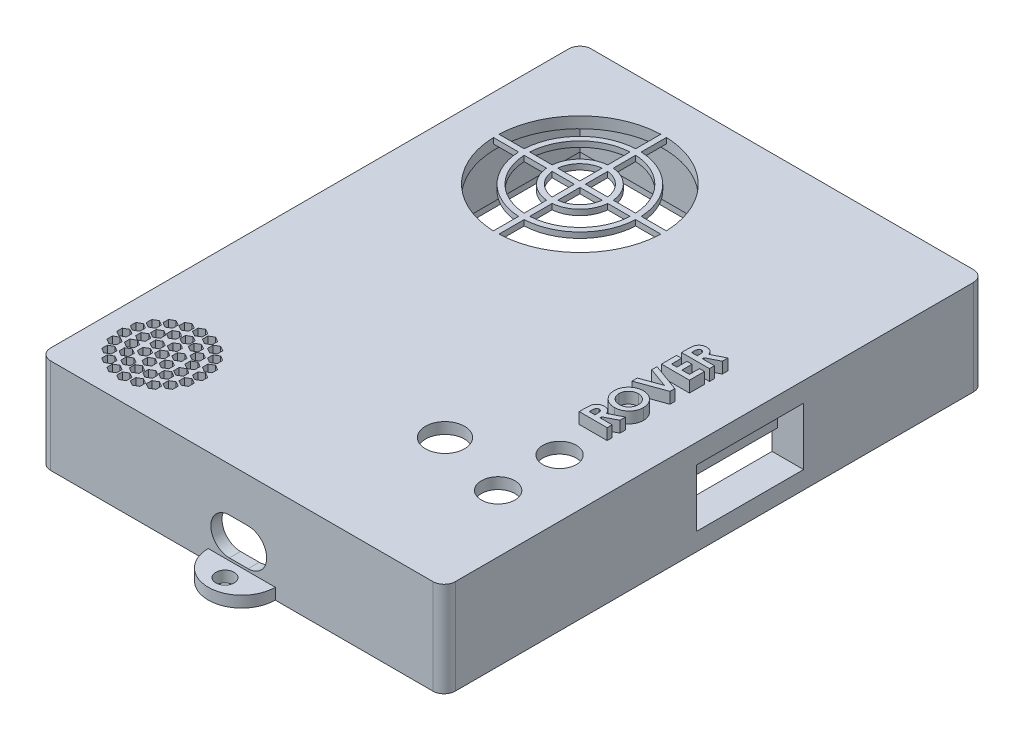
from build123d import *

# Parameters (mm, degrees)
BOSS_EXTRUDE1_START = 10
SKETCH1_W           = 72.5
SKETCH1_H           = 96.828401578
BOSS_EXTRUDE1_DEPTH = 17
SKETCH2_W           = 68.5
SKETCH2_H           = 92.828401578
CUT_EXTRUDE1_DEPTH  = 15
SKETCH3_W           = 70.5
SKETCH3_H           = 94.828401578
SKETCH3_W_2         = 68.5
SKETCH3_H_2         = 92.828401578
CUT_EXTRUDE2_DEPTH  = 2
SKETCH4_R           = 3.5
SKETCH4_R_2         = 3
CUT_EXTRUDE4_DEPTH  = 27
FILLET1_R           = 2
BOSS_EXTRUDE2_START = 10
SKETCH6_R           = 1.65
BOSS_EXTRUDE2_DEPTH = 2
CUT_EXTRUDE5_DEPTH  = 2
VENT1_START         = 25
VENT1_DEPTH         = 2
VENT1_2_DEPTH       = 1
SKETCH12_W          = 21.15
SKETCH12_H          = 12.3
BOSS_EXTRUDE5_DEPTH = 5.65
SKETCH9_W           = 19.15
SKETCH9_H           = 10.3
CUT_EXTRUDE7_DEPTH  = 4.65
SKETCH8_W           = 19.15
SKETCH8_H           = 4.15
CUT_EXTRUDE6_DEPTH  = 5.65
FILL_START          = 25
FILL_PATTERN1_DEPTH = 2
BOSS_EXTRUDE6_DEPTH = 2


# Read off the part's stored shape, not the designer's step: Vent1, Fill Pattern1
with BuildPart() as part:
    # Sketch1 → Boss-Extrude1 (new body)
    with BuildSketch(Plane(origin=(0, 0, 0), x_dir=(1, 0, 0), z_dir=(0, 1, 0)).offset(BOSS_EXTRUDE1_START)):
        with Locations((117.12025684, -15.018542133)):
            Rectangle(SKETCH1_W, SKETCH1_H)
    extrude(amount=BOSS_EXTRUDE1_DEPTH)

    # Sketch2 → Cut-Extrude1 (cut)
    with BuildSketch(Plane.XZ.offset(-10)):
        with Locations((117.12025684, 15.018542133)):
            Rectangle(SKETCH2_W, SKETCH2_H)
    extrude(amount=-CUT_EXTRUDE1_DEPTH, mode=Mode.SUBTRACT)

    # Sketch3 → Cut-Extrude2 (cut)
    with BuildSketch(Plane.XZ.offset(-10)):
        with Locations((117.12025684, 15.018542133)):
            Rectangle(SKETCH3_W, SKETCH3_H)
        with Locations((117.12025684, 15.018542133)):
            Rectangle(SKETCH3_W_2, SKETCH3_H_2, mode=Mode.SUBTRACT)
    extrude(amount=-CUT_EXTRUDE2_DEPTH, mode=Mode.SUBTRACT)

    # Sketch4 → Cut-Extrude4 (cut)
    with BuildSketch(Plane(origin=(0, 0, 0), x_dir=(1, 0, 0), z_dir=(0, 1, 0))):
        with Locations(Location((130.09525684, -39.995717795, 0), (0, 0, 90))):
            Circle(SKETCH4_R)
        with Locations(Location((143.05525684, -43.432742922, 0), (0, 0, 90))):
            Circle(SKETCH4_R_2)
        with Locations(Location((143.05525684, -32.432742922, 0), (0, 0, 90))):
            Circle(SKETCH4_R_2)
    extrude(amount=CUT_EXTRUDE4_DEPTH, mode=Mode.SUBTRACT)

    # Fillet1
    fillet1_edges = [part.edges().sort_by_distance(p)[0] for p in [
        (153.37025684, 18.5, -33.395658656),
        (80.87025684, 18.5, -33.395658656),
        (80.87025684, 18.5, 63.432742922),
        (153.37025684, 18.5, 63.432742922),
    ]]
    fillet(fillet1_edges, radius=FILLET1_R)

    # Sketch6 → Boss-Extrude2 (add)
    with BuildSketch(Plane(origin=(0, 0, 0), x_dir=(1, 0, 0), z_dir=(0, 1, 0)).offset(BOSS_EXTRUDE2_START)):
        with BuildLine():
            Line((111.12025684, -63.432742922), (123.12025684, -63.432742922))
            ThreePointArc((123.12025684, -63.432742922), (117.12025684, -69.432742922), (111.12025684, -63.432742922))
        make_face()
        with Locations(Location((117.12025684, -66.432742922, 0), (0, 0, 90))):
            Circle(SKETCH6_R, mode=Mode.SUBTRACT)
    boss_extrude2 = extrude(amount=BOSS_EXTRUDE2_DEPTH)

    # Mirror1: Boss-Extrude2 across plane
    add(boss_extrude2.mirror(Plane.XY.offset(15.018542133)))

    # Sketch5 → Cut-Extrude5 (cut)
    with BuildSketch(Plane.XY.offset(63.432742922)):
        with BuildLine():
            Line((118.254884649, 12.442001596), (114.904884649, 12.442001596))
            ThreePointArc((114.904884649, 12.442001596), (111.579884649, 15.767001596), (114.904884649, 19.092001596))
            Line((114.904884649, 19.092001596), (118.254884649, 19.092001596))
            ThreePointArc((118.254884649, 19.092001596), (121.579884649, 15.767001596), (118.254884649, 12.442001596))
        make_face()
    extrude(amount=-CUT_EXTRUDE5_DEPTH, mode=Mode.SUBTRACT)

    # Vent1 outline → Vent1 (cut)
    with BuildSketch(Plane(origin=(0, 0, 0), x_dir=(1, 0, 0), z_dir=(0, 1, 0)).offset(VENT1_START)):
        with BuildLine():
            Line((113.358323147, 11.895658638), (117.861902568, 11.895658656))
            add(Edge.make_bspline(
                [(117.861902568, 11.895658656), (117.834686086, 12.710249244), (117.628247174, 14.501168697), (116.817782425, 17.172912915), (115.422698239, 19.782931853), (113.545230768, 22.070632584), (111.257530036, 23.948100055), (108.647511099, 25.343184242), (105.975766881, 26.15364899), (104.184847428, 26.360087902), (103.37025684, 26.387304384)],
                knots=[0.005306189, 0.005306189, 0.005306189, 0.005306189, 0.03125, 0.0625, 0.09375, 0.125, 0.15625, 0.1875, 0.21875, 0.244693811, 0.244693811, 0.244693811, 0.244693811], degree=3))
            Line((103.37025684, 26.387304384), (103.370254985, 21.883725051))
            add(Edge.make_bspline(
                [(113.358323147, 11.895658638), (113.333506456, 12.415558129), (113.186253564, 13.617633929), (112.63352475, 15.439736638), (111.656965819, 17.266749894), (110.34273859, 18.868140406), (108.741348077, 20.182367635), (106.914334821, 21.158926566), (105.092231524, 21.711655559), (103.890155092, 21.858908422), (103.370254985, 21.883725051)],
                knots=[0.007581728, 0.007581728, 0.007581728, 0.007581728, 0.03125, 0.0625, 0.09375, 0.125, 0.15625, 0.1875, 0.21875, 0.2424183, 0.2424183, 0.2424183, 0.2424183], degree=3))
        make_face()
        with BuildLine():
            add(Edge.make_bspline(
                [(103.37025684, -3.595987071), (104.184847428, -3.56877059), (105.975766881, -3.362331677), (108.647511099, -2.551866929), (111.257530036, -1.156782742), (113.545230768, 0.720684728), (115.422698239, 3.00838546), (116.817782425, 5.618404397), (117.628247174, 8.290148616), (117.834686086, 10.081068068), (117.861902568, 10.895658656)],
                knots=[0.755306189, 0.755306189, 0.755306189, 0.755306189, 0.78125, 0.8125, 0.84375, 0.875, 0.90625, 0.9375, 0.96875, 0.994693811, 0.994693811, 0.994693811, 0.994693811], degree=3))
            Line((117.861902568, 10.895658656), (113.358323148, 10.89565868))
            add(Edge.make_bspline(
                [(103.370254494, 0.907592238), (103.890154766, 0.932408851), (105.092231367, 1.079661706), (106.914334821, 1.632390747), (108.741348077, 2.608949677), (110.34273859, 3.923176907), (111.656965819, 5.524567419), (112.63352475, 7.351580675), (113.186253564, 9.173683385), (113.333506457, 10.375759188), (113.358323148, 10.89565868)],
                knots=[0.757581692, 0.757581692, 0.757581692, 0.757581692, 0.78125, 0.8125, 0.84375, 0.875, 0.90625, 0.9375, 0.96875, 0.992418272, 0.992418272, 0.992418272, 0.992418272], degree=3))
            Line((103.370254494, 0.907592238), (103.37025684, -3.595987071))
        make_face()
        with BuildLine():
            Line((102.370259186, 21.883725075), (102.37025684, 26.387304384))
            add(Edge.make_bspline(
                [(102.37025684, 26.387304384), (101.555666252, 26.360087902), (99.7647468, 26.15364899), (97.093002581, 25.343184242), (94.482983644, 23.948100055), (92.195282912, 22.070632584), (90.317815442, 19.782931853), (88.922731255, 17.172912915), (88.112266507, 14.501168697), (87.905827594, 12.710249244), (87.878611112, 11.895658656)],
                knots=[0.255306189, 0.255306189, 0.255306189, 0.255306189, 0.28125, 0.3125, 0.34375, 0.375, 0.40625, 0.4375, 0.46875, 0.494693811, 0.494693811, 0.494693811, 0.494693811], degree=3))
            Line((87.878611112, 11.895658656), (92.382190445, 11.895656801))
            add(Edge.make_bspline(
                [(102.370259186, 21.883725075), (101.850358914, 21.858908462), (100.648282314, 21.711655606), (98.826178859, 21.158926566), (96.999165603, 20.182367635), (95.39777509, 18.868140406), (94.083547861, 17.266749894), (93.10698893, 15.439736638), (92.554259938, 13.61763334), (92.407007075, 12.415556909), (92.382190445, 11.895656801)],
                knots=[0.257581692, 0.257581692, 0.257581692, 0.257581692, 0.28125, 0.3125, 0.34375, 0.375, 0.40625, 0.4375, 0.46875, 0.4924183, 0.4924183, 0.4924183, 0.4924183], degree=3))
        make_face()
        with BuildLine():
            add(Edge.make_bspline(
                [(87.878611112, 10.895658656), (87.905827594, 10.081068068), (88.112266507, 8.290148616), (88.922731255, 5.618404397), (90.317815442, 3.00838546), (92.195282912, 0.720684728), (94.482983644, -1.156782742), (97.093002581, -2.551866929), (99.7647468, -3.362331677), (101.555666252, -3.56877059), (102.37025684, -3.595987071)],
                knots=[0.505306189, 0.505306189, 0.505306189, 0.505306189, 0.53125, 0.5625, 0.59375, 0.625, 0.65625, 0.6875, 0.71875, 0.744693811, 0.744693811, 0.744693811, 0.744693811], degree=3))
            Line((102.37025684, -3.595987071), (102.370258695, 0.907592261))
            add(Edge.make_bspline(
                [(92.382190422, 10.895661002), (92.407007035, 10.37576073), (92.55425989, 9.17368413), (93.10698893, 7.351580675), (94.083547861, 5.524567419), (95.39777509, 3.923176907), (96.999165603, 2.608949677), (98.826178859, 1.632390747), (100.648282156, 1.079661754), (101.850358588, 0.932408891), (102.370258695, 0.907592261)],
                knots=[0.507581692, 0.507581692, 0.507581692, 0.507581692, 0.53125, 0.5625, 0.59375, 0.625, 0.65625, 0.6875, 0.71875, 0.7424183, 0.7424183, 0.7424183, 0.7424183], degree=3))
            Line((92.382190422, 10.895661002), (87.878611112, 10.895658656))
        make_face()
        with BuildLine():
            Line((102.370260777, 16.872863235), (102.370256862, 20.882468742))
            add(Edge.make_bspline(
                [(102.370256862, 20.882468742), (101.915860736, 20.858493483), (100.844616067, 20.724543699), (99.211329143, 20.229091527), (97.558317149, 19.345538209), (96.109440019, 18.156475477), (94.920377288, 16.707598347), (94.036823969, 15.054586354), (93.541371798, 13.42129943), (93.407422014, 12.350054762), (93.383446755, 11.895658637)],
                knots=[0.258380505, 0.258380505, 0.258380505, 0.258380505, 0.28125, 0.3125, 0.34375, 0.375, 0.40625, 0.4375, 0.46875, 0.491619495, 0.491619495, 0.491619495, 0.491619495], degree=3))
            Line((93.383446755, 11.895658637), (97.393052278, 11.895654898))
            add(Edge.make_bspline(
                [(102.370260777, 16.872863235), (102.177982207, 16.855308517), (101.629861878, 16.77606901), (100.751930278, 16.509751371), (99.794923335, 15.998220502), (98.956099733, 15.309815763), (98.267694994, 14.470992162), (97.756164125, 13.513985218), (97.489846504, 12.636053676), (97.410606996, 12.087933408), (97.393052278, 11.895654898)],
                knots=[0.264488585, 0.264488585, 0.264488585, 0.264488585, 0.28125, 0.3125, 0.34375, 0.375, 0.40625, 0.4375, 0.46875, 0.48551141, 0.48551141, 0.48551141, 0.48551141], degree=3))
        make_face()
        with BuildLine():
            Line((108.347461061, 11.895658636), (112.357066925, 11.895658638))
            add(Edge.make_bspline(
                [(112.357066925, 11.895658638), (112.333091666, 12.350054763), (112.199141882, 13.421299431), (111.703689711, 15.054586354), (110.820136392, 16.707598347), (109.631073661, 18.156475477), (108.182196531, 19.345538209), (106.529184537, 20.229091527), (104.895897614, 20.724543699), (103.824652946, 20.858493483), (103.370256821, 20.882468741)],
                knots=[0.008380505, 0.008380505, 0.008380505, 0.008380505, 0.03125, 0.0625, 0.09375, 0.125, 0.15625, 0.1875, 0.21875, 0.241619495, 0.241619495, 0.241619495, 0.241619495], degree=3))
            Line((103.370256821, 20.882468741), (103.370253082, 16.872863219))
            add(Edge.make_bspline(
                [(108.347461061, 11.895658636), (108.329906325, 12.087935887), (108.250666812, 12.636054879), (107.984349555, 13.513985218), (107.472818686, 14.470992162), (106.784413947, 15.309815763), (105.945590345, 15.998220502), (104.988583402, 16.509751371), (104.11065186, 16.776068993), (103.562531592, 16.8553085), (103.370253082, 16.872863219)],
                knots=[0.014488699, 0.014488699, 0.014488699, 0.014488699, 0.03125, 0.0625, 0.09375, 0.125, 0.15625, 0.1875, 0.21875, 0.23551141, 0.23551141, 0.23551141, 0.23551141], degree=3))
        make_face()
        with BuildLine():
            Line((103.370252903, 5.918454078), (103.370256818, 1.908848571))
            add(Edge.make_bspline(
                [(103.370256818, 1.908848571), (103.824652944, 1.93282383), (104.895897613, 2.066773614), (106.529184537, 2.562225786), (108.182196531, 3.445779104), (109.631073661, 4.634841835), (110.820136392, 6.083718965), (111.703689711, 7.736730959), (112.199141883, 9.370017884), (112.333091667, 10.441262554), (112.357066925, 10.89565868)],
                knots=[0.758380505, 0.758380505, 0.758380505, 0.758380505, 0.78125, 0.8125, 0.84375, 0.875, 0.90625, 0.9375, 0.96875, 0.991619495, 0.991619495, 0.991619495, 0.991619495], degree=3))
            Line((112.357066925, 10.89565868), (108.347461062, 10.895658683))
            add(Edge.make_bspline(
                [(103.370252903, 5.918454078), (103.562531473, 5.936008795), (104.110651802, 6.015248303), (104.988583402, 6.281565942), (105.945590345, 6.79309681), (106.784413947, 7.481501549), (107.472818686, 8.320325151), (107.984349555, 9.277332095), (108.250666812, 10.155262436), (108.329906326, 10.703381429), (108.347461062, 10.895658683)],
                knots=[0.764488585, 0.764488585, 0.764488585, 0.764488585, 0.78125, 0.8125, 0.84375, 0.875, 0.90625, 0.9375, 0.96875, 0.985511301, 0.985511301, 0.985511301, 0.985511301], degree=3))
        make_face()
        with BuildLine():
            Line((97.393052262, 10.895662594), (93.383446755, 10.895658679))
            add(Edge.make_bspline(
                [(93.383446755, 10.895658679), (93.407422014, 10.441262553), (93.541371797, 9.370017883), (94.036823969, 7.736730959), (94.920377288, 6.083718965), (96.109440019, 4.634841835), (97.558317149, 3.445779104), (99.211329143, 2.562225786), (100.844616066, 2.066773614), (101.915860735, 1.93282383), (102.37025686, 1.908848571)],
                knots=[0.508380505, 0.508380505, 0.508380505, 0.508380505, 0.53125, 0.5625, 0.59375, 0.625, 0.65625, 0.6875, 0.71875, 0.741619495, 0.741619495, 0.741619495, 0.741619495], degree=3))
            Line((102.37025686, 1.908848571), (102.370260598, 5.918454094))
            add(Edge.make_bspline(
                [(97.393052262, 10.895662594), (97.410606979, 10.703384024), (97.489846486, 10.155263694), (97.756164125, 9.277332095), (98.267694994, 8.320325151), (98.956099733, 7.481501549), (99.794923335, 6.79309681), (100.751930278, 6.281565942), (101.62986182, 6.01524832), (102.177982088, 5.936008813), (102.370260598, 5.918454094)],
                knots=[0.514488585, 0.514488585, 0.514488585, 0.514488585, 0.53125, 0.5625, 0.59375, 0.625, 0.65625, 0.6875, 0.71875, 0.73551141, 0.73551141, 0.73551141, 0.73551141], degree=3))
        make_face()
        with BuildLine():
            Line((102.37025684, 11.895658656), (102.37025684, 15.867777547))
            add(Edge.make_bspline(
                [(102.37025684, 15.867777547), (102.243533436, 15.853612081), (101.826098732, 15.788927709), (101.137080562, 15.579916332), (100.354074881, 15.161391076), (99.667764662, 14.598150835), (99.104524421, 13.911840615), (98.685999164, 13.128834934), (98.476987788, 12.439816764), (98.412303416, 12.02238206), (98.398137949, 11.895658656)],
                knots=[0.267720525, 0.267720525, 0.267720525, 0.267720525, 0.28125, 0.3125, 0.34375, 0.375, 0.40625, 0.4375, 0.46875, 0.482279475, 0.482279475, 0.482279475, 0.482279475], degree=3))
            Line((98.398137949, 11.895658656), (102.37025684, 11.895658656))
        make_face()
        with BuildLine():
            Line((103.37025684, 11.895658656), (107.342375731, 11.895658656))
            add(Edge.make_bspline(
                [(107.342375731, 11.895658656), (107.328210264, 12.02238206), (107.263525893, 12.439816764), (107.054514516, 13.128834934), (106.63598926, 13.911840615), (106.072749018, 14.598150835), (105.386438799, 15.161391076), (104.603433118, 15.579916332), (103.914414948, 15.788927709), (103.496980244, 15.853612081), (103.37025684, 15.867777547)],
                knots=[0.017720525, 0.017720525, 0.017720525, 0.017720525, 0.03125, 0.0625, 0.09375, 0.125, 0.15625, 0.1875, 0.21875, 0.232279475, 0.232279475, 0.232279475, 0.232279475], degree=3))
            Line((103.37025684, 15.867777547), (103.37025684, 11.895658656))
        make_face()
        with BuildLine():
            Line((103.37025684, 10.895658656), (103.370256827, 6.923539764))
            add(Edge.make_bspline(
                [(103.370256827, 6.923539764), (103.496980235, 6.937705231), (103.914414943, 7.002389603), (104.603433118, 7.211400981), (105.386438799, 7.629926237), (106.072749018, 8.193166478), (106.63598926, 8.879476697), (107.054514516, 9.662482379), (107.263525893, 10.351500549), (107.328210264, 10.768935252), (107.342375731, 10.895658656)],
                knots=[0.767720525, 0.767720525, 0.767720525, 0.767720525, 0.78125, 0.8125, 0.84375, 0.875, 0.90625, 0.9375, 0.96875, 0.982279475, 0.982279475, 0.982279475, 0.982279475], degree=3))
            Line((107.342375731, 10.895658656), (103.37025684, 10.895658656))
        make_face()
        with BuildLine():
            Line((102.37025684, 10.895658656), (98.398137949, 10.895658656))
            add(Edge.make_bspline(
                [(98.398137949, 10.895658656), (98.412303416, 10.768935252), (98.476987788, 10.351500549), (98.685999164, 9.662482379), (99.104524421, 8.879476697), (99.667764662, 8.193166478), (100.354074881, 7.629926237), (101.137080562, 7.211400981), (101.826098732, 7.002389604), (102.243533436, 6.937705232), (102.37025684, 6.923539766)],
                knots=[0.517720525, 0.517720525, 0.517720525, 0.517720525, 0.53125, 0.5625, 0.59375, 0.625, 0.65625, 0.6875, 0.71875, 0.732279475, 0.732279475, 0.732279475, 0.732279475], degree=3))
            Line((102.37025684, 6.923539766), (102.37025684, 10.895658656))
        make_face()
    extrude(amount=VENT1_DEPTH, mode=Mode.SUBTRACT)

    # Vent1 2 outline → Vent1 2 (cut)
    with BuildSketch(Plane(origin=(0, 0, 0), x_dir=(1, 0, 0), z_dir=(0, 1, 0)).offset(VENT1_START)):
        with BuildLine():
            add(Edge.make_bspline(
                [(117.861902568, 10.895658656), (117.867469051, 11.062263757), (117.873044629, 11.395658656), (117.867469051, 11.729053555), (117.861902568, 11.895658656)],
                knots=[0.994693811, 0.994693811, 0.994693811, 0.994693811, 1, 1.005306189, 1.005306189, 1.005306189, 1.005306189], degree=3))
            Line((117.861902568, 11.895658656), (113.358323147, 11.895658638))
            add(Edge.make_bspline(
                [(113.358323147, 11.895658638), (113.333506456, 12.415558129), (113.186253564, 13.617633929), (112.63352475, 15.439736638), (111.656965819, 17.266749894), (110.34273859, 18.868140406), (108.741348077, 20.182367635), (106.914334821, 21.158926566), (105.092231524, 21.711655559), (103.890155092, 21.858908422), (103.370254985, 21.883725051)],
                knots=[0.007581728, 0.007581728, 0.007581728, 0.007581728, 0.03125, 0.0625, 0.09375, 0.125, 0.15625, 0.1875, 0.21875, 0.2424183, 0.2424183, 0.2424183, 0.2424183], degree=3))
            Line((103.370254985, 21.883725051), (103.37025684, 26.387304384))
            add(Edge.make_bspline(
                [(103.37025684, 26.387304384), (103.203651739, 26.392870867), (102.87025684, 26.398446446), (102.536861941, 26.392870867), (102.37025684, 26.387304384)],
                knots=[0.244693811, 0.244693811, 0.244693811, 0.244693811, 0.25, 0.255306189, 0.255306189, 0.255306189, 0.255306189], degree=3))
            Line((102.37025684, 26.387304384), (102.370259186, 21.883725075))
            add(Edge.make_bspline(
                [(102.370259186, 21.883725075), (101.850358914, 21.858908462), (100.648282314, 21.711655606), (98.826178859, 21.158926566), (96.999165603, 20.182367635), (95.39777509, 18.868140406), (94.083547861, 17.266749894), (93.10698893, 15.439736638), (92.554259938, 13.61763334), (92.407007075, 12.415556909), (92.382190445, 11.895656801)],
                knots=[0.257581692, 0.257581692, 0.257581692, 0.257581692, 0.28125, 0.3125, 0.34375, 0.375, 0.40625, 0.4375, 0.46875, 0.4924183, 0.4924183, 0.4924183, 0.4924183], degree=3))
            Line((92.382190445, 11.895656801), (87.878611112, 11.895658656))
            add(Edge.make_bspline(
                [(87.878611112, 11.895658656), (87.873044629, 11.729053555), (87.867469051, 11.395658656), (87.873044629, 11.062263757), (87.878611112, 10.895658656)],
                knots=[0.494693811, 0.494693811, 0.494693811, 0.494693811, 0.5, 0.505306189, 0.505306189, 0.505306189, 0.505306189], degree=3))
            Line((87.878611112, 10.895658656), (92.382190422, 10.895661002))
            add(Edge.make_bspline(
                [(92.382190422, 10.895661002), (92.407007035, 10.37576073), (92.55425989, 9.17368413), (93.10698893, 7.351580675), (94.083547861, 5.524567419), (95.39777509, 3.923176907), (96.999165603, 2.608949677), (98.826178859, 1.632390747), (100.648282156, 1.079661754), (101.850358588, 0.932408891), (102.370258695, 0.907592261)],
                knots=[0.507581692, 0.507581692, 0.507581692, 0.507581692, 0.53125, 0.5625, 0.59375, 0.625, 0.65625, 0.6875, 0.71875, 0.7424183, 0.7424183, 0.7424183, 0.7424183], degree=3))
            Line((102.370258695, 0.907592261), (102.37025684, -3.595987071))
            add(Edge.make_bspline(
                [(102.37025684, -3.595987071), (102.536861941, -3.601553554), (102.87025684, -3.607129133), (103.203651739, -3.601553554), (103.37025684, -3.595987071)],
                knots=[0.744693811, 0.744693811, 0.744693811, 0.744693811, 0.75, 0.755306189, 0.755306189, 0.755306189, 0.755306189], degree=3))
            Line((103.37025684, -3.595987071), (103.370254494, 0.907592238))
            add(Edge.make_bspline(
                [(103.370254494, 0.907592238), (103.890154766, 0.932408851), (105.092231367, 1.079661706), (106.914334821, 1.632390747), (108.741348077, 2.608949677), (110.34273859, 3.923176907), (111.656965819, 5.524567419), (112.63352475, 7.351580675), (113.186253564, 9.173683385), (113.333506457, 10.375759188), (113.358323148, 10.89565868)],
                knots=[0.757581692, 0.757581692, 0.757581692, 0.757581692, 0.78125, 0.8125, 0.84375, 0.875, 0.90625, 0.9375, 0.96875, 0.992418272, 0.992418272, 0.992418272, 0.992418272], degree=3))
            Line((113.358323148, 10.89565868), (117.861902568, 10.895658656))
        make_face()
        with BuildLine():
            add(Edge.make_bspline(
                [(93.383446755, 10.895658679), (93.407422014, 10.441262553), (93.541371797, 9.370017883), (94.036823969, 7.736730959), (94.920377288, 6.083718965), (96.109440019, 4.634841835), (97.558317149, 3.445779104), (99.211329143, 2.562225786), (100.844616066, 2.066773614), (101.915860735, 1.93282383), (102.37025686, 1.908848571)],
                knots=[0.508380505, 0.508380505, 0.508380505, 0.508380505, 0.53125, 0.5625, 0.59375, 0.625, 0.65625, 0.6875, 0.71875, 0.741619495, 0.741619495, 0.741619495, 0.741619495], degree=3))
            Line((93.383446755, 10.895658679), (97.393052262, 10.895662594))
            add(Edge.make_bspline(
                [(97.393052262, 10.895662594), (97.410606979, 10.703384024), (97.489846486, 10.155263694), (97.756164125, 9.277332095), (98.267694994, 8.320325151), (98.956099733, 7.481501549), (99.794923335, 6.79309681), (100.751930278, 6.281565942), (101.62986182, 6.01524832), (102.177982088, 5.936008813), (102.370260598, 5.918454094)],
                knots=[0.514488585, 0.514488585, 0.514488585, 0.514488585, 0.53125, 0.5625, 0.59375, 0.625, 0.65625, 0.6875, 0.71875, 0.73551141, 0.73551141, 0.73551141, 0.73551141], degree=3))
            Line((102.370260598, 5.918454094), (102.37025686, 1.908848571))
        make_face(mode=Mode.SUBTRACT)
        with BuildLine():
            add(Edge.make_bspline(
                [(98.398137949, 10.895658656), (98.412303416, 10.768935252), (98.476987788, 10.351500549), (98.685999164, 9.662482379), (99.104524421, 8.879476697), (99.667764662, 8.193166478), (100.354074881, 7.629926237), (101.137080562, 7.211400981), (101.826098732, 7.002389604), (102.243533436, 6.937705232), (102.37025684, 6.923539766)],
                knots=[0.517720525, 0.517720525, 0.517720525, 0.517720525, 0.53125, 0.5625, 0.59375, 0.625, 0.65625, 0.6875, 0.71875, 0.732279475, 0.732279475, 0.732279475, 0.732279475], degree=3))
            Line((98.398137949, 10.895658656), (102.37025684, 10.895658656))
            Line((102.37025684, 10.895658656), (102.37025684, 6.923539766))
        make_face(mode=Mode.SUBTRACT)
        with BuildLine():
            add(Edge.make_bspline(
                [(103.370256818, 1.908848571), (103.824652944, 1.93282383), (104.895897613, 2.066773614), (106.529184537, 2.562225786), (108.182196531, 3.445779104), (109.631073661, 4.634841835), (110.820136392, 6.083718965), (111.703689711, 7.736730959), (112.199141883, 9.370017884), (112.333091667, 10.441262554), (112.357066925, 10.89565868)],
                knots=[0.758380505, 0.758380505, 0.758380505, 0.758380505, 0.78125, 0.8125, 0.84375, 0.875, 0.90625, 0.9375, 0.96875, 0.991619495, 0.991619495, 0.991619495, 0.991619495], degree=3))
            Line((103.370256818, 1.908848571), (103.370252903, 5.918454078))
            add(Edge.make_bspline(
                [(103.370252903, 5.918454078), (103.562531473, 5.936008795), (104.110651802, 6.015248303), (104.988583402, 6.281565942), (105.945590345, 6.79309681), (106.784413947, 7.481501549), (107.472818686, 8.320325151), (107.984349555, 9.277332095), (108.250666812, 10.155262436), (108.329906326, 10.703381429), (108.347461062, 10.895658683)],
                knots=[0.764488585, 0.764488585, 0.764488585, 0.764488585, 0.78125, 0.8125, 0.84375, 0.875, 0.90625, 0.9375, 0.96875, 0.985511301, 0.985511301, 0.985511301, 0.985511301], degree=3))
            Line((108.347461062, 10.895658683), (112.357066925, 10.89565868))
        make_face(mode=Mode.SUBTRACT)
        with BuildLine():
            add(Edge.make_bspline(
                [(103.370256827, 6.923539764), (103.496980235, 6.937705231), (103.914414943, 7.002389603), (104.603433118, 7.211400981), (105.386438799, 7.629926237), (106.072749018, 8.193166478), (106.63598926, 8.879476697), (107.054514516, 9.662482379), (107.263525893, 10.351500549), (107.328210264, 10.768935252), (107.342375731, 10.895658656)],
                knots=[0.767720525, 0.767720525, 0.767720525, 0.767720525, 0.78125, 0.8125, 0.84375, 0.875, 0.90625, 0.9375, 0.96875, 0.982279475, 0.982279475, 0.982279475, 0.982279475], degree=3))
            Line((103.370256827, 6.923539764), (103.37025684, 10.895658656))
            Line((103.37025684, 10.895658656), (107.342375731, 10.895658656))
        make_face(mode=Mode.SUBTRACT)
        with BuildLine():
            add(Edge.make_bspline(
                [(102.37025684, 15.867777547), (102.243533436, 15.853612081), (101.826098732, 15.788927709), (101.137080562, 15.579916332), (100.354074881, 15.161391076), (99.667764662, 14.598150835), (99.104524421, 13.911840615), (98.685999164, 13.128834934), (98.476987788, 12.439816764), (98.412303416, 12.02238206), (98.398137949, 11.895658656)],
                knots=[0.267720525, 0.267720525, 0.267720525, 0.267720525, 0.28125, 0.3125, 0.34375, 0.375, 0.40625, 0.4375, 0.46875, 0.482279475, 0.482279475, 0.482279475, 0.482279475], degree=3))
            Line((102.37025684, 15.867777547), (102.37025684, 11.895658656))
            Line((102.37025684, 11.895658656), (98.398137949, 11.895658656))
        make_face(mode=Mode.SUBTRACT)
        with BuildLine():
            add(Edge.make_bspline(
                [(102.370256862, 20.882468742), (101.915860736, 20.858493483), (100.844616067, 20.724543699), (99.211329143, 20.229091527), (97.558317149, 19.345538209), (96.109440019, 18.156475477), (94.920377288, 16.707598347), (94.036823969, 15.054586354), (93.541371798, 13.42129943), (93.407422014, 12.350054762), (93.383446755, 11.895658637)],
                knots=[0.258380505, 0.258380505, 0.258380505, 0.258380505, 0.28125, 0.3125, 0.34375, 0.375, 0.40625, 0.4375, 0.46875, 0.491619495, 0.491619495, 0.491619495, 0.491619495], degree=3))
            Line((102.370256862, 20.882468742), (102.370260777, 16.872863235))
            add(Edge.make_bspline(
                [(102.370260777, 16.872863235), (102.177982207, 16.855308517), (101.629861878, 16.77606901), (100.751930278, 16.509751371), (99.794923335, 15.998220502), (98.956099733, 15.309815763), (98.267694994, 14.470992162), (97.756164125, 13.513985218), (97.489846504, 12.636053676), (97.410606996, 12.087933408), (97.393052278, 11.895654898)],
                knots=[0.264488585, 0.264488585, 0.264488585, 0.264488585, 0.28125, 0.3125, 0.34375, 0.375, 0.40625, 0.4375, 0.46875, 0.48551141, 0.48551141, 0.48551141, 0.48551141], degree=3))
            Line((97.393052278, 11.895654898), (93.383446755, 11.895658637))
        make_face(mode=Mode.SUBTRACT)
        with BuildLine():
            add(Edge.make_bspline(
                [(107.342375731, 11.895658656), (107.328210264, 12.02238206), (107.263525893, 12.439816764), (107.054514516, 13.128834934), (106.63598926, 13.911840615), (106.072749018, 14.598150835), (105.386438799, 15.161391076), (104.603433118, 15.579916332), (103.914414948, 15.788927709), (103.496980244, 15.853612081), (103.37025684, 15.867777547)],
                knots=[0.017720525, 0.017720525, 0.017720525, 0.017720525, 0.03125, 0.0625, 0.09375, 0.125, 0.15625, 0.1875, 0.21875, 0.232279475, 0.232279475, 0.232279475, 0.232279475], degree=3))
            Line((107.342375731, 11.895658656), (103.37025684, 11.895658656))
            Line((103.37025684, 11.895658656), (103.37025684, 15.867777547))
        make_face(mode=Mode.SUBTRACT)
        with BuildLine():
            add(Edge.make_bspline(
                [(112.357066925, 11.895658638), (112.333091666, 12.350054763), (112.199141882, 13.421299431), (111.703689711, 15.054586354), (110.820136392, 16.707598347), (109.631073661, 18.156475477), (108.182196531, 19.345538209), (106.529184537, 20.229091527), (104.895897614, 20.724543699), (103.824652946, 20.858493483), (103.370256821, 20.882468741)],
                knots=[0.008380505, 0.008380505, 0.008380505, 0.008380505, 0.03125, 0.0625, 0.09375, 0.125, 0.15625, 0.1875, 0.21875, 0.241619495, 0.241619495, 0.241619495, 0.241619495], degree=3))
            Line((112.357066925, 11.895658638), (108.347461061, 11.895658636))
            add(Edge.make_bspline(
                [(108.347461061, 11.895658636), (108.329906325, 12.087935887), (108.250666812, 12.636054879), (107.984349555, 13.513985218), (107.472818686, 14.470992162), (106.784413947, 15.309815763), (105.945590345, 15.998220502), (104.988583402, 16.509751371), (104.11065186, 16.776068993), (103.562531592, 16.8553085), (103.370253082, 16.872863219)],
                knots=[0.014488699, 0.014488699, 0.014488699, 0.014488699, 0.03125, 0.0625, 0.09375, 0.125, 0.15625, 0.1875, 0.21875, 0.23551141, 0.23551141, 0.23551141, 0.23551141], degree=3))
            Line((103.370253082, 16.872863219), (103.370256821, 20.882468741))
        make_face(mode=Mode.SUBTRACT)
    extrude(amount=VENT1_2_DEPTH, mode=Mode.SUBTRACT)

    # Sketch12 → Boss-Extrude5 (add)
    with BuildSketch(Plane(origin=(153.37025684, 0, 0), x_dir=(0, 0, -1), z_dir=(1, 0, 0))):
        with Locations((-8.604341344, 18.331581069)):
            Rectangle(SKETCH12_W, SKETCH12_H)
    extrude(amount=-BOSS_EXTRUDE5_DEPTH)

    # Sketch9 → Cut-Extrude7 (cut)
    with BuildSketch(Plane(origin=(153.37025684, 0, 0), x_dir=(0, 0, -1), z_dir=(1, 0, 0))):
        with Locations((-8.604341344, 18.331581069)):
            Rectangle(SKETCH9_W, SKETCH9_H)
    extrude(amount=-CUT_EXTRUDE7_DEPTH, mode=Mode.SUBTRACT)

    # Sketch8 → Cut-Extrude6 (cut)
    with BuildSketch(Plane(origin=(153.37025684, 0, 0), x_dir=(0, 0, -1), z_dir=(1, 0, 0))):
        with Locations((-8.604341344, 15.256581069)):
            Rectangle(SKETCH8_W, SKETCH8_H)
        with Locations((-8.604341344, 21.406581069)):
            Rectangle(SKETCH8_W, SKETCH8_H)
    extrude(amount=-CUT_EXTRUDE6_DEPTH, mode=Mode.SUBTRACT)

    # Fill Pattern1 outline → Fill Pattern1 (cut)
    with BuildSketch(Plane(origin=(0, 0, 0), x_dir=(1, 0, 0), z_dir=(0, 1, 0)).offset(FILL_START)):
        Polygon((91.87025684, -53.432742922), (92.736282244, -52.932742922), (92.736282244, -51.932742922), (91.87025684, -51.432742922), (91.004231436, -51.932742922), (91.004231436, -52.932742922), align=None)
        Polygon((93.829848634, -52.301372073), (94.695874038, -51.801372073), (94.695874038, -50.801372073), (93.829848634, -50.301372073), (92.963823231, -50.801372073), (92.963823231, -51.801372073), align=None)
        Polygon((89.910665046, -54.564113772), (90.77669045, -54.064113772), (90.77669045, -53.064113772), (89.910665046, -52.564113772), (89.044639642, -53.064113772), (89.044639642, -54.064113772), align=None)
        Polygon((92.736282244, -50.670001223), (92.736282244, -49.670001223), (91.87025684, -49.170001223), (91.004231436, -49.670001223), (91.004231436, -50.670001223), (91.87025684, -51.170001223), align=None)
        Polygon((92.736282244, -59.720968022), (92.736282244, -58.720968022), (91.87025684, -58.220968022), (91.004231436, -58.720968022), (91.004231436, -59.720968022), (91.87025684, -60.220968022), align=None)
        Polygon((92.736282244, -57.458226322), (92.736282244, -56.458226322), (91.87025684, -55.958226322), (91.004231436, -56.458226322), (91.004231436, -57.458226322), (91.87025684, -57.958226322), align=None)
        Polygon((92.736282244, -55.195484622), (92.736282244, -54.195484622), (91.87025684, -53.695484622), (91.004231436, -54.195484622), (91.004231436, -55.195484622), (91.87025684, -55.695484622), align=None)
        Polygon((92.736282244, -46.144517823), (92.736282244, -45.144517823), (91.87025684, -44.644517823), (91.004231436, -45.144517823), (91.004231436, -46.144517823), (91.87025684, -46.644517823), align=None)
        Polygon((92.736282244, -48.407259523), (92.736282244, -47.407259523), (91.87025684, -46.907259523), (91.004231436, -47.407259523), (91.004231436, -48.407259523), (91.87025684, -48.907259523), align=None)
        Polygon((94.695874038, -53.064113772), (93.829848634, -52.564113772), (92.963823231, -53.064113772), (92.963823231, -54.064113772), (93.829848634, -54.564113772), (94.695874038, -54.064113772), align=None)
        Polygon((90.77669045, -50.801372073), (89.910665046, -50.301372073), (89.044639642, -50.801372073), (89.044639642, -51.801372073), (89.910665046, -52.301372073), (90.77669045, -51.801372073), align=None)
        Polygon((98.658481939, -53.432742922), (99.524507343, -52.932742922), (99.524507343, -51.932742922), (98.658481939, -51.432742922), (97.792456536, -51.932742922), (97.792456536, -52.932742922), align=None)
        Polygon((98.326242555, -51.335066005), (99.192267959, -50.835066005), (99.192267959, -49.835066005), (98.326242555, -49.335066005), (97.460217151, -49.835066005), (97.460217151, -50.835066005), align=None)
        Polygon((99.192267959, -55.03041984), (99.192267959, -54.03041984), (98.326242555, -53.53041984), (97.460217151, -54.03041984), (97.460217151, -55.03041984), (98.326242555, -55.53041984), align=None)
        Polygon((97.362046307, -49.44272432), (98.228071711, -48.94272432), (98.228071711, -47.94272432), (97.362046307, -47.44272432), (96.496020903, -47.94272432), (96.496020903, -48.94272432), align=None)
        Polygon((98.228071711, -56.922761525), (98.228071711, -55.922761525), (97.362046307, -55.422761525), (96.496020903, -55.922761525), (96.496020903, -56.922761525), (97.362046307, -57.422761525), align=None)
        Polygon((93.833790499, -57.510062578), (94.699815903, -57.010062578), (94.699815903, -56.010062578), (93.833790499, -55.510062578), (92.967765095, -56.010062578), (92.967765095, -57.010062578), align=None)
        Polygon((94.699815903, -48.855423267), (94.699815903, -47.855423267), (93.833790499, -47.355423267), (92.967765095, -47.855423267), (92.967765095, -48.855423267), (93.833790499, -49.355423267), align=None)
        Polygon((93.967933757, -59.888728637), (94.833959161, -59.388728637), (94.833959161, -58.388728637), (93.967933757, -57.888728637), (93.101908354, -58.388728637), (93.101908354, -59.388728637), align=None)
        Polygon((94.833959161, -46.476757208), (94.833959161, -45.476757208), (93.967933757, -44.976757208), (93.101908354, -45.476757208), (93.101908354, -46.476757208), (93.967933757, -46.976757208), align=None)
        Polygon((95.860275443, -58.924532389), (96.726300847, -58.424532389), (96.726300847, -57.424532389), (95.860275443, -56.924532389), (94.994250039, -57.424532389), (94.994250039, -58.424532389), align=None)
        Polygon((96.726300847, -47.440953455), (96.726300847, -46.440953455), (95.860275443, -45.940953455), (94.994250039, -46.440953455), (94.994250039, -47.440953455), (95.860275443, -47.940953455), align=None)
        Polygon((86.378467373, -57.422761525), (87.244492777, -56.922761525), (87.244492777, -55.922761525), (86.378467373, -55.422761525), (85.512441969, -55.922761525), (85.512441969, -56.922761525), align=None)
        Polygon((87.244492777, -48.94272432), (87.244492777, -47.94272432), (86.378467373, -47.44272432), (85.512441969, -47.94272432), (85.512441969, -48.94272432), (86.378467373, -49.44272432), align=None)
        Polygon((87.458236758, -54.439757715), (88.324262161, -53.939757715), (88.324262161, -52.939757715), (87.458236758, -52.439757715), (86.592211354, -52.939757715), (86.592211354, -53.939757715), align=None)
        Polygon((88.324262161, -51.92572813), (88.324262161, -50.92572813), (87.458236758, -50.42572813), (86.592211354, -50.92572813), (86.592211354, -51.92572813), (87.458236758, -52.42572813), align=None)
        Polygon((87.880238237, -58.924532389), (88.746263641, -58.424532389), (88.746263641, -57.424532389), (87.880238237, -56.924532389), (87.014212834, -57.424532389), (87.014212834, -58.424532389), align=None)
        Polygon((88.746263641, -47.440953455), (88.746263641, -46.440953455), (87.880238237, -45.940953455), (87.014212834, -46.440953455), (87.014212834, -47.440953455), (87.880238237, -47.940953455), align=None)
        Polygon((85.414271125, -55.53041984), (86.280296529, -55.03041984), (86.280296529, -54.03041984), (85.414271125, -53.53041984), (84.548245721, -54.03041984), (84.548245721, -55.03041984), align=None)
        Polygon((86.280296529, -50.835066005), (86.280296529, -49.835066005), (85.414271125, -49.335066005), (84.548245721, -49.835066005), (84.548245721, -50.835066005), (85.414271125, -51.335066005), align=None)
        Polygon((88.332091445, -56.254335671), (89.198116849, -55.754335671), (89.198116849, -54.754335671), (88.332091445, -54.254335671), (87.466066041, -54.754335671), (87.466066041, -55.754335671), align=None)
        Polygon((89.198116849, -50.111150174), (89.198116849, -49.111150174), (88.332091445, -48.611150174), (87.466066041, -49.111150174), (87.466066041, -50.111150174), (88.332091445, -50.611150174), align=None)
        Polygon((89.772579923, -59.888728637), (90.638605327, -59.388728637), (90.638605327, -58.388728637), (89.772579923, -57.888728637), (88.906554519, -58.388728637), (88.906554519, -59.388728637), align=None)
        Polygon((90.638605327, -46.476757208), (90.638605327, -45.476757208), (89.772579923, -44.976757208), (88.906554519, -45.476757208), (88.906554519, -46.476757208), (89.772579923, -46.976757208), align=None)
        Polygon((89.906723181, -57.510062578), (90.772748585, -57.010062578), (90.772748585, -56.010062578), (89.906723181, -55.510062578), (89.040697778, -56.010062578), (89.040697778, -57.010062578), align=None)
        Polygon((90.772748585, -48.855423267), (90.772748585, -47.855423267), (89.906723181, -47.355423267), (89.040697778, -47.855423267), (89.040697778, -48.855423267), (89.906723181, -49.355423267), align=None)
        Polygon((96.282276922, -52.42572813), (97.148302326, -51.92572813), (97.148302326, -50.92572813), (96.282276922, -50.42572813), (95.416251519, -50.92572813), (95.416251519, -51.92572813), align=None)
        Polygon((97.148302326, -53.939757715), (97.148302326, -52.939757715), (96.282276922, -52.439757715), (95.416251519, -52.939757715), (95.416251519, -53.939757715), (96.282276922, -54.439757715), align=None)
        Polygon((95.408422235, -50.611150174), (96.274447639, -50.111150174), (96.274447639, -49.111150174), (95.408422235, -48.611150174), (94.542396831, -49.111150174), (94.542396831, -50.111150174), align=None)
        Polygon((96.274447639, -55.754335671), (96.274447639, -54.754335671), (95.408422235, -54.254335671), (94.542396831, -54.754335671), (94.542396831, -55.754335671), (95.408422235, -56.254335671), align=None)
        Polygon((85.082031741, -53.432742922), (85.948057144, -52.932742922), (85.948057144, -51.932742922), (85.082031741, -51.432742922), (84.216006337, -51.932742922), (84.216006337, -52.932742922), align=None)
    extrude(amount=FILL_PATTERN1_DEPTH, mode=Mode.SUBTRACT)

    # Sketch17 → Boss-Extrude6 (add)
    # profile 1 of 5: a face of its own
    with BuildSketch(Plane(origin=(0, 27, 0), x_dir=(-1, 0, 0), z_dir=(0, 1, 0))):
        with BuildLine():
            Line((-140.09258061, 25.948029313), (-140.09258061, 24.902356236))
            add(Edge.make_bspline(
                [(-140.09258061, 24.902356236), (-140.092825188, 24.833237453), (-140.093295581, 24.700302564), (-140.100749967, 24.508619486), (-140.111075996, 24.332525956), (-140.127026806, 24.171459685), (-140.147653097, 24.026057938), (-140.172676981, 23.896012754), (-140.200947162, 23.781248618), (-140.235596653, 23.680215557), (-140.275499379, 23.589289764), (-140.320538079, 23.504771464), (-140.372414615, 23.425170837), (-140.429026978, 23.34902683), (-140.492402818, 23.277698574), (-140.56202855, 23.211383704), (-140.637402312, 23.14922952), (-140.718070864, 23.091153774), (-140.803921592, 23.039472992), (-140.893735485, 22.99368637), (-140.987755242, 22.95606836), (-141.08544262, 22.924745788), (-141.186915089, 22.900629314), (-141.292106768, 22.884255119), (-141.401062374, 22.872147902), (-141.475090499, 22.871458107), (-141.512853046, 22.871106236)],
                knots=[0, 0, 0, 0, 1.749037589, 3.363891962, 4.853828513, 6.212420965, 7.458679178, 8.568887289, 9.562757098, 10.447168552, 11.268163578, 12.073310924, 12.867792413, 13.67045336, 14.472446998, 15.279188696, 16.101356728, 16.943088626, 17.792208908, 18.634830833, 19.491484118, 20.351879174, 21.228996054, 22.12769993, 23.044919519, 24, 24, 24, 24], degree=3))
            add(Edge.make_bspline(
                [(-141.512853046, 22.871106236), (-141.552267701, 22.872026182), (-141.629552656, 22.873830028), (-141.743077952, 22.883546526), (-141.851691014, 22.901305232), (-141.955073837, 22.928203375), (-142.05451314, 22.959119298), (-142.148174207, 23.000229544), (-142.237419201, 23.046626521), (-142.320985719, 23.101730854), (-142.40072994, 23.162205167), (-142.473596566, 23.232535522), (-142.543501904, 23.308165591), (-142.606067319, 23.393346816), (-142.66552326, 23.484324329), (-142.719406176, 23.582905758), (-142.76907056, 23.688447727), (-142.796766852, 23.762648958), (-142.810929969, 23.800593415)],
                knots=[0, 0, 0, 0, 1.099860209, 2.156625411, 3.176576793, 4.16617041, 5.135385252, 6.078461593, 7.016046972, 7.938469504, 8.868247731, 9.803980173, 10.76021508, 11.73834243, 12.748633912, 13.790971185, 14.870363756, 16, 16, 16, 16], degree=3))
            Line((-142.810929969, 23.800593415), (-145.09258061, 22.646747261))
            Line((-145.09258061, 22.646747261), (-145.09258061, 23.644343415))
            Line((-145.09258061, 23.644343415), (-142.91309343, 24.746106236))
            Line((-142.91309343, 24.746106236), (-142.91309343, 25.050593415))
            Line((-142.91309343, 25.050593415), (-145.09258061, 25.050593415))
            Line((-145.09258061, 25.050593415), (-145.09258061, 25.948029313))
            Line((-145.09258061, 25.948029313), (-140.09258061, 25.948029313))
        make_face()
        with BuildLine():
            Line((-142.015657533, 25.050593415), (-142.015657533, 24.70103412))
            add(Edge.make_bspline(
                [(-142.015657533, 24.70103412), (-142.015176212, 24.658297584), (-142.014254587, 24.5764663), (-142.009979553, 24.458782274), (-141.999679357, 24.351896733), (-141.986664084, 24.255352318), (-141.971640331, 24.168657942), (-141.950095907, 24.092603736), (-141.927052566, 24.025964324), (-141.898278412, 23.969696515), (-141.866131381, 23.921426409), (-141.828000251, 23.880966201), (-141.786229621, 23.845322212), (-141.738190426, 23.817362759), (-141.685850823, 23.794773323), (-141.628226092, 23.780764084), (-141.566359599, 23.76964908), (-141.523261271, 23.768921007), (-141.500833815, 23.768542133)],
                knots=[0, 0, 0, 0, 1.688935225, 3.233948049, 4.651771667, 5.929878493, 7.083962697, 8.124219224, 9.050753627, 9.864999381, 10.615157594, 11.334035464, 12.05533055, 12.777108108, 13.522027315, 14.29964284, 15.115170198, 16, 16, 16, 16], degree=3))
            add(Edge.make_bspline(
                [(-141.500833815, 23.768542133), (-141.474335024, 23.769560032), (-141.422283061, 23.771559505), (-141.347347514, 23.791401595), (-141.277985554, 23.822983449), (-141.214529986, 23.866282484), (-141.158843081, 23.920778411), (-141.110154279, 23.983211096), (-141.070756578, 24.054501561), (-141.045524337, 24.120981083), (-141.03001497, 24.181884041), (-141.019005323, 24.236668362), (-141.010468876, 24.300281301), (-141.002204968, 24.372367901), (-140.996516711, 24.453238167), (-140.992491978, 24.542742742), (-140.99082198, 24.640932211), (-140.990292729, 24.709380681), (-140.990016507, 24.745104633)],
                knots=[0, 0, 0, 0, 1.020213939, 2.004021227, 2.966357326, 3.948562114, 4.950324333, 5.960000531, 6.991850424, 8.080015304, 8.69218159, 9.414443227, 10.233931419, 11.166782034, 12.212677862, 13.359889063, 14.622099264, 16, 16, 16, 16], degree=3))
            Line((-140.990016507, 24.745104633), (-140.990016507, 25.050593415))
            Line((-140.990016507, 25.050593415), (-142.015657533, 25.050593415))
        make_face(mode=Mode.SUBTRACT)
    # profile 2 of 5: a face of its own
    with BuildSketch(Plane(origin=(0, 27, 0), x_dir=(-1, 0, 0), z_dir=(0, 1, 0))):
        with BuildLine():
            add(Edge.make_bspline(
                [(-139.964375482, 19.559808159), (-139.966624942, 19.472876326), (-139.971065885, 19.3012532), (-140.008126063, 19.048869715), (-140.068407153, 18.805604185), (-140.15266925, 18.571508159), (-140.261435562, 18.346899598), (-140.395153902, 18.132354302), (-140.551742626, 17.926487217), (-140.730914105, 17.733098962), (-140.926704952, 17.555709894), (-141.135453612, 17.399743825), (-141.354830984, 17.267708837), (-141.584642547, 17.159733857), (-141.825366906, 17.076124045), (-142.076878364, 17.0177623), (-142.338712695, 16.980179789), (-142.51699586, 16.975863834), (-142.607604648, 16.973670338)],
                knots=[0, 0, 0, 0, 1.014244935, 2.002349224, 2.970143685, 3.935298574, 4.900830986, 5.877310296, 6.881148894, 7.915268703, 8.949887647, 9.960720774, 10.951801935, 11.933244874, 12.919141415, 13.920101769, 14.942934067, 16, 16, 16, 16], degree=3))
            add(Edge.make_bspline(
                [(-142.607604648, 16.973670338), (-142.697192585, 16.976006302), (-142.87372849, 16.980609394), (-143.133148473, 17.016230665), (-143.381971007, 17.075569739), (-143.620338693, 17.157793828), (-143.848303271, 17.263690044), (-144.065626665, 17.393394372), (-144.271480434, 17.5480905), (-144.465359465, 17.72268142), (-144.641292217, 17.914894905), (-144.796755048, 18.118556035), (-144.927544817, 18.333259801), (-145.035565476, 18.557488787), (-145.119076496, 18.792223404), (-145.17805571, 19.036930781), (-145.213884858, 19.291652378), (-145.218462311, 19.464873309), (-145.220785738, 19.552796941)],
                knots=[0, 0, 0, 0, 1.051446269, 2.071908608, 3.067230498, 4.050151293, 5.026863609, 6.012936299, 7.01551645, 8.045060801, 9.071444569, 10.070117656, 11.048150216, 12.017576978, 12.987003741, 13.967083865, 14.968130643, 16, 16, 16, 16], degree=3))
            add(Edge.make_bspline(
                [(-145.220785738, 19.552796941), (-145.218701774, 19.644754705), (-145.21460707, 19.825439143), (-145.175668299, 20.089871627), (-145.117012908, 20.343220796), (-145.029472885, 20.58335837), (-144.920040494, 20.812729946), (-144.785267943, 21.029650263), (-144.625377956, 21.234046422), (-144.444465373, 21.424745973), (-144.246507327, 21.597520228), (-144.037382206, 21.750027397), (-143.818687543, 21.878670578), (-143.590320983, 21.983454477), (-143.353701768, 22.066061893), (-143.107388821, 22.12433204), (-142.851972888, 22.158753606), (-142.678489281, 22.16354833), (-142.590577405, 22.16597803)],
                knots=[0, 0, 0, 0, 1.067978421, 2.098431617, 3.099715153, 4.085208694, 5.062210972, 6.048429807, 7.046490867, 8.072918869, 9.098532598, 10.095778865, 11.076610158, 12.041847152, 13.011192615, 13.984257998, 14.978533688, 16, 16, 16, 16], degree=3))
            add(Edge.make_bspline(
                [(-142.590577405, 22.16597803), (-142.531437376, 22.165205151), (-142.413906168, 22.163669177), (-142.239687203, 22.145564587), (-142.069112616, 22.118730162), (-141.901889231, 22.081933454), (-141.738645069, 22.032672353), (-141.57903334, 21.972008002), (-141.422434112, 21.902221823), (-141.270358723, 21.820896353), (-141.124274195, 21.730414714), (-140.984849696, 21.631706755), (-140.85378246, 21.52450248), (-140.730185488, 21.409168923), (-140.614962339, 21.285243323), (-140.505965086, 21.154386836), (-140.407587965, 21.013328813), (-140.31525006, 20.866656669), (-140.232508468, 20.714625006), (-140.161209168, 20.558105141), (-140.099719766, 20.399497669), (-140.050907887, 20.236897516), (-140.011204173, 20.072194084), (-139.984935192, 19.903664331), (-139.9666808, 19.732821063), (-139.965145745, 19.617615991), (-139.964375482, 19.559808159)],
                knots=[0, 0, 0, 0, 1.034751683, 2.056401036, 3.062285641, 4.056148242, 5.050783641, 6.043890034, 7.043081327, 8.049576835, 9.059882113, 10.048974407, 11.037410495, 12.021414423, 13.005418351, 13.997561464, 14.999568372, 16.012961702, 17.030138968, 18.026421002, 19.021605583, 20.005054086, 20.995836695, 21.984410968, 22.988613675, 24, 24, 24, 24], degree=3))
        make_face()
        with BuildLine():
            add(Edge.make_bspline(
                [(-140.861811379, 19.573830595), (-140.863381192, 19.632335229), (-140.866479374, 19.747799967), (-140.890083274, 19.917165757), (-140.927781533, 20.079762711), (-140.982386477, 20.234690362), (-141.051886583, 20.382616953), (-141.136030601, 20.523816787), (-141.237743053, 20.656288755), (-141.351441694, 20.781975846), (-141.478651439, 20.895130555), (-141.613493055, 20.996871966), (-141.759211056, 21.079134027), (-141.911005888, 21.149867655), (-142.072716278, 21.202115379), (-142.241717683, 21.241896573), (-142.41974502, 21.26356404), (-142.540777744, 21.266859128), (-142.602596635, 21.268542133)],
                knots=[0, 0, 0, 0, 1.033668485, 2.040047952, 3.016132939, 3.979056467, 4.937231767, 5.900589077, 6.877725736, 7.88429546, 8.891280164, 9.882584218, 10.863295226, 11.842887319, 12.837417301, 13.860812229, 14.907384602, 16, 16, 16, 16], degree=3))
            add(Edge.make_bspline(
                [(-142.602596635, 21.268542133), (-142.671126909, 21.266500988), (-142.80543489, 21.262500683), (-143.001431664, 21.234635495), (-143.186141584, 21.186237763), (-143.360202037, 21.118900196), (-143.522723668, 21.031313821), (-143.674582987, 20.925128314), (-143.815039335, 20.799401533), (-143.89709012, 20.702659129), (-143.938734456, 20.653558159)],
                knots=[0, 0, 0, 0, 1.078379799, 2.113445728, 3.107478808, 4.077334175, 5.043482131, 6.005506737, 6.987708079, 8, 8, 8, 8], degree=3))
            add(Edge.make_bspline(
                [(-143.938734456, 20.653558159), (-143.969496369, 20.613327761), (-144.030327125, 20.533773363), (-144.108294218, 20.406787223), (-144.175119794, 20.276016504), (-144.229114069, 20.140474376), (-144.271585058, 20.000447098), (-144.301326794, 19.855953871), (-144.319992305, 19.707199431), (-144.322223187, 19.606604707), (-144.323349841, 19.555801748)],
                knots=[0, 0, 0, 0, 1.023928204, 2.024787132, 3.009472467, 3.9914905, 4.972207045, 5.96565515, 6.972602802, 8, 8, 8, 8], degree=3))
            add(Edge.make_bspline(
                [(-144.323349841, 19.555801748), (-144.321766801, 19.498303038), (-144.318652121, 19.385172517), (-144.295337606, 19.218960482), (-144.25588728, 19.059720222), (-144.201745173, 18.906482496), (-144.13143314, 18.759617191), (-144.044308311, 18.619887917), (-143.942898181, 18.486272527), (-143.827239156, 18.360805252), (-143.699969082, 18.246221467), (-143.56372177, 18.145959378), (-143.420222415, 18.060792246), (-143.269368081, 17.991745298), (-143.111208684, 17.936868751), (-142.94552091, 17.899633809), (-142.772900541, 17.875637617), (-142.655429563, 17.872635584), (-142.595585418, 17.871106236)],
                knots=[0, 0, 0, 0, 1.026250569, 2.01918027, 2.989144455, 3.950556051, 4.91558185, 5.889785058, 6.885144561, 7.905911388, 8.931486752, 9.937601838, 10.920932928, 11.905004308, 12.894547393, 13.903711934, 14.932071819, 16, 16, 16, 16], degree=3))
            add(Edge.make_bspline(
                [(-142.595585418, 17.871106236), (-142.536085112, 17.872688009), (-142.418967835, 17.875801488), (-142.246795272, 17.899155872), (-142.081824275, 17.938360268), (-141.923785428, 17.992649105), (-141.772523795, 18.061973076), (-141.6285713, 18.147699198), (-141.492067112, 18.24952667), (-141.363941453, 18.365111938), (-141.246202179, 18.490919398), (-141.144025893, 18.625986277), (-141.055237948, 18.766533252), (-140.985685058, 18.915785157), (-140.930272418, 19.070688422), (-140.889465754, 19.232188275), (-140.866645187, 19.400896407), (-140.863437011, 19.515672038), (-140.861811379, 19.573830595)],
                knots=[0, 0, 0, 0, 1.055025985, 2.07665775, 3.074803781, 4.057872707, 5.035505728, 6.020516407, 7.023567878, 8.050795229, 9.077271434, 10.074415901, 11.050397877, 12.019801805, 12.988065821, 13.964604439, 14.968634123, 16, 16, 16, 16], degree=3))
        make_face(mode=Mode.SUBTRACT)
    # profile 3 of 5: a face of its own
    with BuildSketch(Plane(origin=(0, 27, 0), x_dir=(-1, 0, 0), z_dir=(0, 1, 0))):
        Polygon((-140.09258061, 16.492901107), (-140.09258061, 15.534367454), (-143.644263302, 14.249311364), (-140.09258061, 12.961250466), (-140.09258061, 12.00572162), (-145.09258061, 13.818622261), (-145.09258061, 14.683005274), align=None)
    # profile 4 of 5: a face of its own
    with BuildSketch(Plane(origin=(0, 27, 0), x_dir=(-1, 0, 0), z_dir=(0, 1, 0))):
        Polygon((-140.09258061, 11.204439569), (-140.09258061, 8.512131877), (-140.990016507, 8.512131877), (-140.990016507, 10.307003671), (-141.951554969, 10.307003671), (-141.951554969, 8.512131877), (-142.848990866, 8.512131877), (-142.848990866, 10.307003671), (-144.195144712, 10.307003671), (-144.195144712, 8.512131877), (-145.09258061, 8.512131877), (-145.09258061, 11.204439569), align=None)
    # profile 5 of 5: a face of its own
    with BuildSketch(Plane(origin=(0, 27, 0), x_dir=(-1, 0, 0), z_dir=(0, 1, 0))):
        with BuildLine():
            Line((-140.09258061, 7.614695979), (-140.09258061, 6.569022902))
            add(Edge.make_bspline(
                [(-140.09258061, 6.569022902), (-140.092825188, 6.49990412), (-140.093295581, 6.366969231), (-140.100749967, 6.175286153), (-140.111075996, 5.999192622), (-140.127026806, 5.838126352), (-140.147653097, 5.692724605), (-140.172676981, 5.562679421), (-140.200947162, 5.447915284), (-140.235596653, 5.346882223), (-140.275499379, 5.25595643), (-140.320538079, 5.17143813), (-140.372414615, 5.091837504), (-140.429026978, 5.015693497), (-140.492402818, 4.944365241), (-140.56202855, 4.87805037), (-140.637402312, 4.815896187), (-140.718070864, 4.75782044), (-140.803921592, 4.706139659), (-140.893735485, 4.660353037), (-140.987755242, 4.622735026), (-141.08544262, 4.591412454), (-141.186915089, 4.56729598), (-141.292106768, 4.550921786), (-141.401062374, 4.538814568), (-141.475090499, 4.538124774), (-141.512853046, 4.537772902)],
                knots=[0, 0, 0, 0, 1.749037589, 3.363891962, 4.853828513, 6.212420965, 7.458679178, 8.568887289, 9.562757098, 10.447168552, 11.268163578, 12.073310924, 12.867792413, 13.67045336, 14.472446998, 15.279188696, 16.101356728, 16.943088626, 17.792208908, 18.634830833, 19.491484118, 20.351879174, 21.228996054, 22.12769993, 23.044919519, 24, 24, 24, 24], degree=3))
            add(Edge.make_bspline(
                [(-141.512853046, 4.537772902), (-141.552267701, 4.538692848), (-141.629552656, 4.540496695), (-141.743077952, 4.550213193), (-141.851691014, 4.567971898), (-141.955073837, 4.594870042), (-142.05451314, 4.625785965), (-142.148174207, 4.666896211), (-142.237419201, 4.713293187), (-142.320985719, 4.76839752), (-142.40072994, 4.828871834), (-142.473596566, 4.899202188), (-142.543501904, 4.974832257), (-142.606067319, 5.060013482), (-142.66552326, 5.150990996), (-142.719406176, 5.249572425), (-142.76907056, 5.355114394), (-142.796766852, 5.429315624), (-142.810929969, 5.467260082)],
                knots=[0, 0, 0, 0, 1.099860209, 2.156625411, 3.176576793, 4.16617041, 5.135385252, 6.078461593, 7.016046972, 7.938469504, 8.868247731, 9.803980173, 10.76021508, 11.73834243, 12.748633912, 13.790971185, 14.870363756, 16, 16, 16, 16], degree=3))
            Line((-142.810929969, 5.467260082), (-145.09258061, 4.313413928))
            Line((-145.09258061, 4.313413928), (-145.09258061, 5.311010082))
            Line((-145.09258061, 5.311010082), (-142.91309343, 6.412772902))
            Line((-142.91309343, 6.412772902), (-142.91309343, 6.717260082))
            Line((-142.91309343, 6.717260082), (-145.09258061, 6.717260082))
            Line((-145.09258061, 6.717260082), (-145.09258061, 7.614695979))
            Line((-145.09258061, 7.614695979), (-140.09258061, 7.614695979))
        make_face()
        with BuildLine():
            Line((-142.015657533, 6.717260082), (-142.015657533, 6.367700787))
            add(Edge.make_bspline(
                [(-142.015657533, 6.367700787), (-142.015176212, 6.324964251), (-142.014254587, 6.243132966), (-142.009979553, 6.12544894), (-141.999679357, 6.0185634), (-141.986664084, 5.922018985), (-141.971640331, 5.835324609), (-141.950095907, 5.759270403), (-141.927052566, 5.692630991), (-141.898278412, 5.636363181), (-141.866131381, 5.588093076), (-141.828000251, 5.547632867), (-141.786229621, 5.511988879), (-141.738190426, 5.484029426), (-141.685850823, 5.46143999), (-141.628226092, 5.447430751), (-141.566359599, 5.436315747), (-141.523261271, 5.435587674), (-141.500833815, 5.4352088)],
                knots=[0, 0, 0, 0, 1.688935225, 3.233948049, 4.651771667, 5.929878493, 7.083962697, 8.124219224, 9.050753627, 9.864999381, 10.615157594, 11.334035464, 12.05533055, 12.777108108, 13.522027315, 14.29964284, 15.115170198, 16, 16, 16, 16], degree=3))
            add(Edge.make_bspline(
                [(-141.500833815, 5.4352088), (-141.474335024, 5.436226698), (-141.422283061, 5.438226172), (-141.347347514, 5.458068261), (-141.277985554, 5.489650116), (-141.214529986, 5.532949151), (-141.158843081, 5.587445078), (-141.110154279, 5.649877763), (-141.070756578, 5.721168228), (-141.045524337, 5.78764775), (-141.03001497, 5.848550707), (-141.019005323, 5.903335029), (-141.010468876, 5.966947967), (-141.002204968, 6.039034567), (-140.996516711, 6.119904833), (-140.992491978, 6.209409409), (-140.99082198, 6.307598878), (-140.990292729, 6.376047348), (-140.990016507, 6.4117713)],
                knots=[0, 0, 0, 0, 1.020213939, 2.004021227, 2.966357326, 3.948562114, 4.950324333, 5.960000531, 6.991850424, 8.080015304, 8.69218159, 9.414443227, 10.233931419, 11.166782034, 12.212677862, 13.359889063, 14.622099264, 16, 16, 16, 16], degree=3))
            Line((-140.990016507, 6.4117713), (-140.990016507, 6.717260082))
            Line((-140.990016507, 6.717260082), (-142.015657533, 6.717260082))
        make_face(mode=Mode.SUBTRACT)
    extrude(amount=BOSS_EXTRUDE6_DEPTH)


solid = part.part
